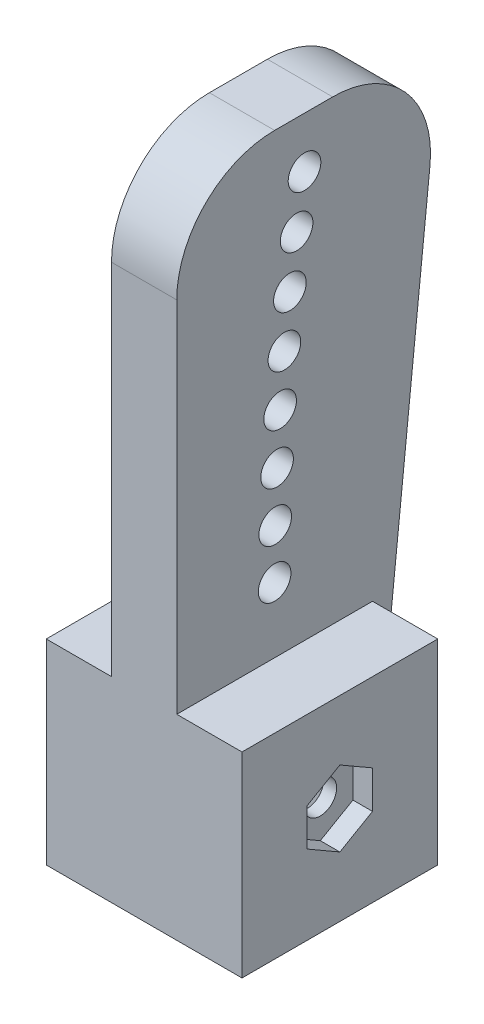
from build123d import *

# Parameters (mm, degrees)
SKETCH1_W             = 30
SKETCH1_H             = 30
SKETCH1_W_2           = 20
SKETCH1_H_2           = 20
BOSS_EXTRUDE1_DEPTH   = 20
BOSS_EXTRUDE2_START   = 20
SKETCH1_2_W           = 30
SKETCH1_2_H           = 30
SKETCH1_2_W_2         = 20
SKETCH1_2_H_2         = 20
BOSS_EXTRUDE2_DEPTH   = 10
SKETCH3_R             = 2.5
CUT_EXTRUDE1_DEPTH    = 46
SKETCH3_3_R           = 4
SKETCH3_3_R_2         = 2.5
CUT_EXTRUDE2_DEPTH    = 3
CUT_EXTRUDE3_START    = -27
SKETCH3_4_R           = 4
SKETCH3_4_R_2         = 2.5
CUT_EXTRUDE3_DEPTH    = 3
BOSS_EXTRUDE4_DEPTH   = 5
FILLET2_R             = 15
SKETCH7_R             = 2.5
CUT_EXTRUDE5_DEPTH    = 105.74180253
CRVPATTERN1_START     = -5
CRVPATTERN1_OUTLINE_R = 2.5
CRVPATTERN1_DEPTH     = 10


# Read off the part's stored shape, not the designer's step: CrvPattern1
with BuildPart() as part:
    # Sketch1 → Boss-Extrude1 (new body)
    with BuildSketch(Plane(origin=(0, 0, 0), x_dir=(1, 0, 0), z_dir=(0, 1, 0))):
        Rectangle(SKETCH1_W, SKETCH1_H)
        Rectangle(SKETCH1_W_2, SKETCH1_H_2, mode=Mode.SUBTRACT)
    extrude(amount=BOSS_EXTRUDE1_DEPTH)

    # Sketch1<2> → Boss-Extrude2 (add)
    # profile 1 of 2: a face of its own
    with BuildSketch(Plane(origin=(0, 0, 0), x_dir=(1, 0, 0), z_dir=(0, 1, 0)).offset(BOSS_EXTRUDE2_START)):
        Rectangle(SKETCH1_2_W, SKETCH1_2_H)
        Rectangle(SKETCH1_2_W_2, SKETCH1_2_H_2, mode=Mode.SUBTRACT)
    # profile 2 of 2: a face of its own
    with BuildSketch(Plane(origin=(0, 0, 0), x_dir=(1, 0, 0), z_dir=(0, 1, 0)).offset(BOSS_EXTRUDE2_START)):
        Rectangle(SKETCH1_2_W_2, SKETCH1_2_H_2)
    extrude(amount=BOSS_EXTRUDE2_DEPTH)

    # Sketch3 → Cut-Extrude1 (cut, through all)
    with BuildSketch(Plane(origin=(15, 0, 0), x_dir=(0, 0, -1), z_dir=(1, 0, 0))):
        with Locations((0, 15)):
            Circle(SKETCH3_R)
    extrude(amount=-CUT_EXTRUDE1_DEPTH, mode=Mode.SUBTRACT)

    # Sketch3<3> → Cut-Extrude2 (cut)
    # profile 1 of 2: a face of its own
    with BuildSketch(Plane(origin=(15, 0, 0), x_dir=(0, 0, -1), z_dir=(1, 0, 0))):
        Polygon((-5, 17.886751346), (-5, 12.113248654), (0, 9.226497308), (5, 12.113248654), (5, 17.886751346), (0, 20.773502692), align=None)
        with Locations((0, 15)):
            Circle(SKETCH3_3_R, mode=Mode.SUBTRACT)
    # profile 2 of 2: a face of its own
    with BuildSketch(Plane(origin=(15, 0, 0), x_dir=(0, 0, -1), z_dir=(1, 0, 0))):
        with Locations((0, 15)):
            Circle(SKETCH3_3_R)
        with Locations((0, 15)):
            Circle(SKETCH3_3_R_2, mode=Mode.SUBTRACT)
    extrude(amount=-CUT_EXTRUDE2_DEPTH, mode=Mode.SUBTRACT)

    # Sketch3<4> → Cut-Extrude3 (cut)
    with BuildSketch(Plane(origin=(15, 0, 0), x_dir=(0, 0, -1), z_dir=(1, 0, 0)).offset(CUT_EXTRUDE3_START)):
        with Locations((0, 15)):
            Circle(SKETCH3_4_R)
        with Locations((0, 15)):
            Circle(SKETCH3_4_R_2, mode=Mode.SUBTRACT)
    extrude(amount=-CUT_EXTRUDE3_DEPTH, mode=Mode.SUBTRACT)

    # Sketch6 → Boss-Extrude4 (add, symmetric)
    with BuildSketch(Plane(origin=(0, 0, 0), x_dir=(0, 0, -1), z_dir=(1, 0, 0))):
        Polygon((-15, 30), (-15, 100), (25.559724605, 100), (15, 0), (15, 30), align=None)
    extrude(amount=BOSS_EXTRUDE4_DEPTH, both=True)

    # Fillet2
    fillet2_edges = [part.edges().sort_by_distance(p)[0] for p in [
        (0, 100, -25.559724605),
        (0, 100, 15),
    ]]
    fillet(fillet2_edges, radius=FILLET2_R)

    # Sketch7 → Cut-Extrude5 (cut, through all)
    with BuildSketch(Plane(origin=(5, 0, 0), x_dir=(0, 0, -1), z_dir=(1, 0, 0))):
        with Locations((0, 40)):
            Circle(SKETCH7_R)
    extrude(amount=-CUT_EXTRUDE5_DEPTH, mode=Mode.SUBTRACT)

    # CrvPattern1 outline → CrvPattern1 (cut)
    with BuildSketch(Plane.YZ.offset(CRVPATTERN1_START)):
        with Locations((47.499218774, -0.093745117)):
            Circle(CRVPATTERN1_OUTLINE_R)
        with Locations((92.232441278, -4.582038329)):
            Circle(CRVPATTERN1_OUTLINE_R)
        with Locations((84.831439742, -3.368676619)):
            Circle(CRVPATTERN1_OUTLINE_R)
        with Locations((77.402420016, -2.340699831)):
            Circle(CRVPATTERN1_OUTLINE_R)
        with Locations((69.950024994, -1.498750417)):
            Circle(CRVPATTERN1_OUTLINE_R)
        with Locations((62.478912182, -0.843354566)):
            Circle(CRVPATTERN1_OUTLINE_R)
        with Locations((54.993750781, -0.374921882)):
            Circle(CRVPATTERN1_OUTLINE_R)
    extrude(amount=CRVPATTERN1_DEPTH, mode=Mode.SUBTRACT)


solid = part.part
